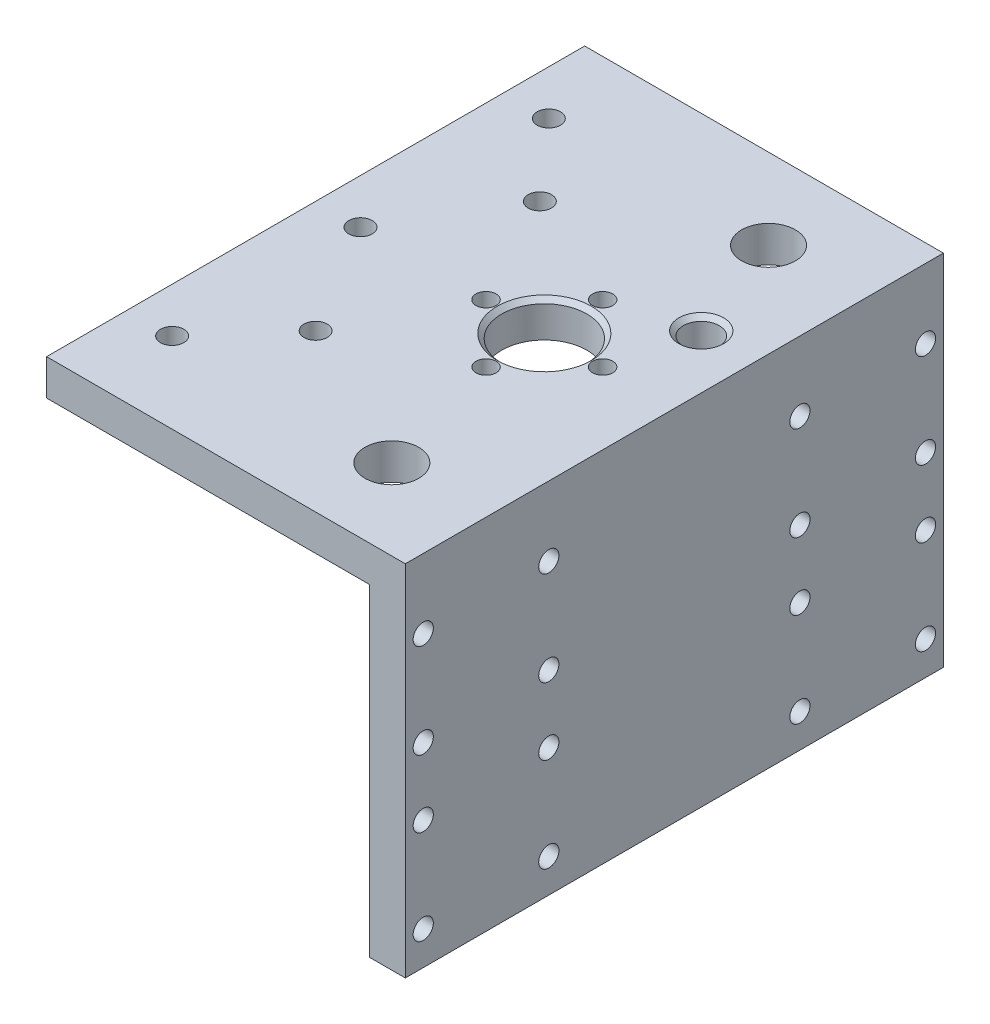
from build123d import *

# Parameters (mm, degrees)
ESTRUSIONE_ESTRUSIONE1_DEPTH = 120
TAGLIO_ESTRUSIONE2_REACH     = 166.924
SCHIZZO6_R                   = 6
TAGLIO_ESTRUSIONE3_REACH     = 166.924
SCHIZZO7_R                   = 9.5
SCHIZZO7_R_2                 = 4
FORO_PER_VITE_M4_2_D         = 4.5
SCHIZZO12_R                  = 2.25
TAGLIO_ESTRUSIONE4_DEPTH     = 10
SCHIZZO14_R                  = 2.6
TAGLIO_ESTRUSIONE5_DEPTH     = 10
SMUSSO1_SIZE                 = 1
SMUSSO2_SIZE                 = 1


with BuildPart() as part:
    # Schizzo1 → Estrusione-Estrusione1 (new body)
    with BuildSketch(Plane.XY):
        Polygon((0, 0), (-80, 0), (-80, -8), (-8, -8), (-8, -80), (0, -80), align=None)
    extrude(amount=ESTRUSIONE_ESTRUSIONE1_DEPTH)

    # Schizzo6 → Taglio-Estrusione2 (cut, up to next)
    with BuildSketch(Plane(origin=(0, 0, 0), x_dir=(1, 0, 0), z_dir=(0, 1, 0)), mode=Mode.PRIVATE) as taglio_estrusione2_sk1:
        with Locations((-21, -18)):
            Circle(SCHIZZO6_R)
    taglio_estrusione2_tool1 = extrude(taglio_estrusione2_sk1.sketch, amount=-TAGLIO_ESTRUSIONE2_REACH, mode=Mode.PRIVATE) & part.part
    # Schizzo6 → Taglio-Estrusione2 (cut, up to next)
    with BuildSketch(Plane(origin=(0, 0, 0), x_dir=(1, 0, 0), z_dir=(0, 1, 0)), mode=Mode.PRIVATE) as taglio_estrusione2_sk2:
        with Locations((-21, -102)):
            Circle(SCHIZZO6_R)
    taglio_estrusione2_tool2 = extrude(taglio_estrusione2_sk2.sketch, amount=-TAGLIO_ESTRUSIONE2_REACH, mode=Mode.PRIVATE) & part.part
    add(taglio_estrusione2_tool1.solids().sort_by_distance((-21, 0, 18))[0], mode=Mode.SUBTRACT)
    add(taglio_estrusione2_tool2.solids().sort_by_distance((-21, 0, 102))[0], mode=Mode.SUBTRACT)

    # Schizzo7 → Taglio-Estrusione3 (cut, up to next)
    with BuildSketch(Plane(origin=(0, 0, 0), x_dir=(1, 0, 0), z_dir=(0, 1, 0)), mode=Mode.PRIVATE) as taglio_estrusione3_sk1:
        with Locations((-29, -60)):
            Circle(SCHIZZO7_R)
    taglio_estrusione3_tool1 = extrude(taglio_estrusione3_sk1.sketch, amount=-TAGLIO_ESTRUSIONE3_REACH, mode=Mode.PRIVATE) & part.part
    # Schizzo7 → Taglio-Estrusione3 (cut, up to next)
    with BuildSketch(Plane(origin=(0, 0, 0), x_dir=(1, 0, 0), z_dir=(0, 1, 0)), mode=Mode.PRIVATE) as taglio_estrusione3_sk2:
        with Locations((-12, -42)):
            Circle(SCHIZZO7_R_2)
    taglio_estrusione3_tool2 = extrude(taglio_estrusione3_sk2.sketch, amount=-TAGLIO_ESTRUSIONE3_REACH, mode=Mode.PRIVATE) & part.part
    add(taglio_estrusione3_tool1.solids().sort_by_distance((-29, 0, 60))[0], mode=Mode.SUBTRACT)
    add(taglio_estrusione3_tool2.solids().sort_by_distance((-12, 0, 42))[0], mode=Mode.SUBTRACT)

    # Foro per Vite M4-2 (through all)
    with Locations(Plane(origin=(0, 0, 0), x_dir=(1, 0, 0), z_dir=(0, 1, 0))):
        with Locations((-29, -47), (-42, -60), (-29, -73), (-16, -60), (-29, -60)):
            Hole(FORO_PER_VITE_M4_2_D / 2)

    # Schizzo12 → Taglio-Estrusione4 (cut)
    with BuildSketch(Plane(origin=(0, 0, 0), x_dir=(0, 0, -1), z_dir=(1, 0, 0))):
        with Locations((-116, -15.5)):
            Circle(SCHIZZO12_R)
        with Locations((-88, -15.5)):
            Circle(SCHIZZO12_R)
        with Locations((-88, -36.5)):
            Circle(SCHIZZO12_R)
        with Locations((-116, -36.5)):
            Circle(SCHIZZO12_R)
        with Locations((-32, -36.5)):
            Circle(SCHIZZO12_R)
        with Locations((-4, -36.5)):
            Circle(SCHIZZO12_R)
        with Locations((-32, -15.5)):
            Circle(SCHIZZO12_R)
        with Locations((-4, -15.5)):
            Circle(SCHIZZO12_R)
        with Locations((-116, -51.5)):
            Circle(SCHIZZO12_R)
        with Locations((-88, -51.5)):
            Circle(SCHIZZO12_R)
        with Locations((-88, -72.5)):
            Circle(SCHIZZO12_R)
        with Locations((-116, -72.5)):
            Circle(SCHIZZO12_R)
        with Locations((-4, -72.5)):
            Circle(SCHIZZO12_R)
        with Locations((-32, -72.5)):
            Circle(SCHIZZO12_R)
        with Locations((-32, -51.5)):
            Circle(SCHIZZO12_R)
        with Locations((-4, -51.5)):
            Circle(SCHIZZO12_R)
    extrude(amount=-TAGLIO_ESTRUSIONE4_DEPTH, mode=Mode.SUBTRACT)

    # Schizzo14 → Taglio-Estrusione5 (cut)
    with BuildSketch(Plane(origin=(0, 0, 0), x_dir=(1, 0, 0), z_dir=(0, 1, 0))):
        with Locations((-70, -18)):
            Circle(SCHIZZO14_R)
        with Locations((-70, -60)):
            Circle(SCHIZZO14_R)
        with Locations((-70, -102)):
            Circle(SCHIZZO14_R)
        with Locations((-55, -35)):
            Circle(SCHIZZO14_R)
        with Locations((-55, -85)):
            Circle(SCHIZZO14_R)
    extrude(amount=-TAGLIO_ESTRUSIONE5_DEPTH, mode=Mode.SUBTRACT)

    # Smusso1
    smusso1_edges = [part.edges().sort_by_distance(p)[0] for p in [
        (-16, 0, 42),
    ]]
    chamfer(smusso1_edges, length=SMUSSO1_SIZE)

    # Smusso2
    smusso2_edges = [part.edges().sort_by_distance(p)[0] for p in [
        (-38.5, 0, 60),
    ]]
    chamfer(smusso2_edges, length=SMUSSO2_SIZE)


solid = part.part
